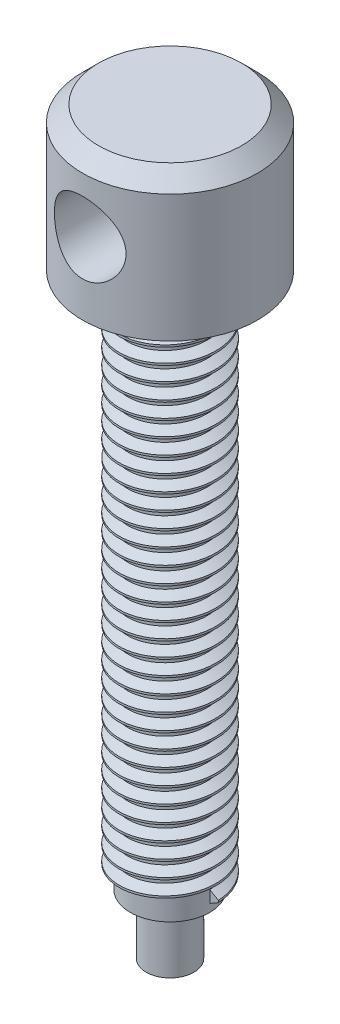
from build123d import *

# Parameters (mm, degrees)
CUT_EXTRUDE1_DEPTH      = 95.292099351
CUT_EXTRUDE1_DEPTH_BACK = 95.292099351
SKETCH2_R               = 4.5
THREAD1_PITCH           = 2


with BuildPart() as part:
    # Sketch1 → Revolve1 (revolve)
    with BuildSketch(Plane.XY, mode=Mode.PRIVATE) as revolve1_sk:
        with BuildLine():
            ThreePointArc((5, 7.514876279), (4.007347783, 7.787730549), (3, 8))
            Line((3, 8), (3, 0))
            Line((3, 0), (0, 0))
            Line((0, 0), (0, 93))
            Line((0, 93), (9, 93))
            Line((9, 93), (11, 91))
            Line((11, 91), (11, 75))
            Line((11, 75), (5, 75))
            Line((5, 75), (5, 7.514876279))
        make_face()
    revolve(revolve1_sk.sketch.rotate(Axis((0, 0, 0), (0, 1, 0)), 90), axis=Axis((0, 0, 0), (0, 1, 0)))

    # Sketch2 → Cut-Extrude1 (cut, two sides: drawn at the far end of the back side and taken through both)
    with BuildSketch(Plane.XY.offset(-CUT_EXTRUDE1_DEPTH_BACK)):
        with Locations((0, 84)):
            Circle(SKETCH2_R)
    extrude(amount=CUT_EXTRUDE1_DEPTH + CUT_EXTRUDE1_DEPTH_BACK, mode=Mode.SUBTRACT)

    # Thread1: arcs per turn and ends read off the stored shape
    # Thread1: the profile of Thread Profile1 profile screwed along a right-hand helix through 31.5 turns, 10 arcs to a turn; built about Z, then put on its axis
    thread1_z = Axis((0, 0, 0), (0, 0, 1))
    thread1_corners = [(4.9997, 0, -0.000173205), (6.08253175, 0, 0.624999997), (6.08253175, 0, 0.874999997), (4.9997, 0, 1.5001732)]
    with BuildLine(mode=Mode.PRIVATE) as thread1_profile:
        Line(thread1_corners[0], thread1_corners[1])
        Line(thread1_corners[1], thread1_corners[2])
        Line(thread1_corners[2], thread1_corners[3])
        Line(thread1_corners[3], thread1_corners[0])
    thread1_cap = Face(thread1_profile.wire())
    thread1_turn_angles = [0, 18, 36, 54, 72, 90, 108, 126, 144, 162, 180, 198, 216, 234, 252, 270, 288, 306, 324, 342, 360]
    thread1_turn_weights = [1, 0.9510565162951535, 1, 0.9510565162951535, 1, 0.9510565162951535, 1, 0.9510565162951535, 1, 0.9510565162951535, 1, 0.9510565162951535, 1, 0.9510565162951535, 1, 0.9510565162951535, 1, 0.9510565162951535, 1, 0.9510565162951535, 1]
    thread1_turn_rails = [Edge.make_bspline([Vector(p[0], p[1], 0).rotate(thread1_z, thread1_turn_angles[k]) / thread1_turn_weights[k] + Vector(0, 0, p[2] + THREAD1_PITCH * thread1_turn_angles[k] / 360) for k in range(21)], [0, 0, 0, 1, 1, 2, 2, 3, 3, 4, 4, 5, 5, 6, 6, 7, 7, 8, 8, 9, 9, 10, 10, 10], 2, thread1_turn_weights) for p in thread1_corners]
    thread1_turn_sides = [Face.make_surface_from_curves(thread1_turn_rails[p[0]], thread1_turn_rails[p[1]]) for p in [(0, 1), (1, 2), (2, 3), (3, 0)]]
    thread1_last_angles = [11160, 11178, 11196, 11214, 11232, 11250, 11268, 11286, 11304, 11322, 11340]
    thread1_last_weights = [1, 0.9510565162951535, 1, 0.9510565162951535, 1, 0.9510565162951535, 1, 0.9510565162951535, 1, 0.9510565162951535, 1]
    thread1_last_rails = [Edge.make_bspline([Vector(p[0], p[1], 0).rotate(thread1_z, thread1_last_angles[k]) / thread1_last_weights[k] + Vector(0, 0, p[2] + THREAD1_PITCH * thread1_last_angles[k] / 360) for k in range(11)], [0, 0, 0, 1, 1, 2, 2, 3, 3, 4, 4, 5, 5, 5], 2, thread1_last_weights) for p in thread1_corners]
    thread1_last_sides = [Face.make_surface_from_curves(thread1_last_rails[p[0]], thread1_last_rails[p[1]]) for p in [(0, 1), (1, 2), (2, 3), (3, 0)]]
    thread1 = Plane(origin=(0, 73, 0), x_dir=(-1, 0, 0), z_dir=(0, -1, 0)) * Solid(Shell([*[p.moved(Location((0, 0, THREAD1_PITCH * i))) for i in range(31) for p in thread1_turn_sides], *thread1_last_sides, thread1_cap, thread1_cap.rotate(thread1_z, 11340).moved(Location((0, 0, THREAD1_PITCH * 11340 / 360)))]))
    add(thread1)


solid = part.part
